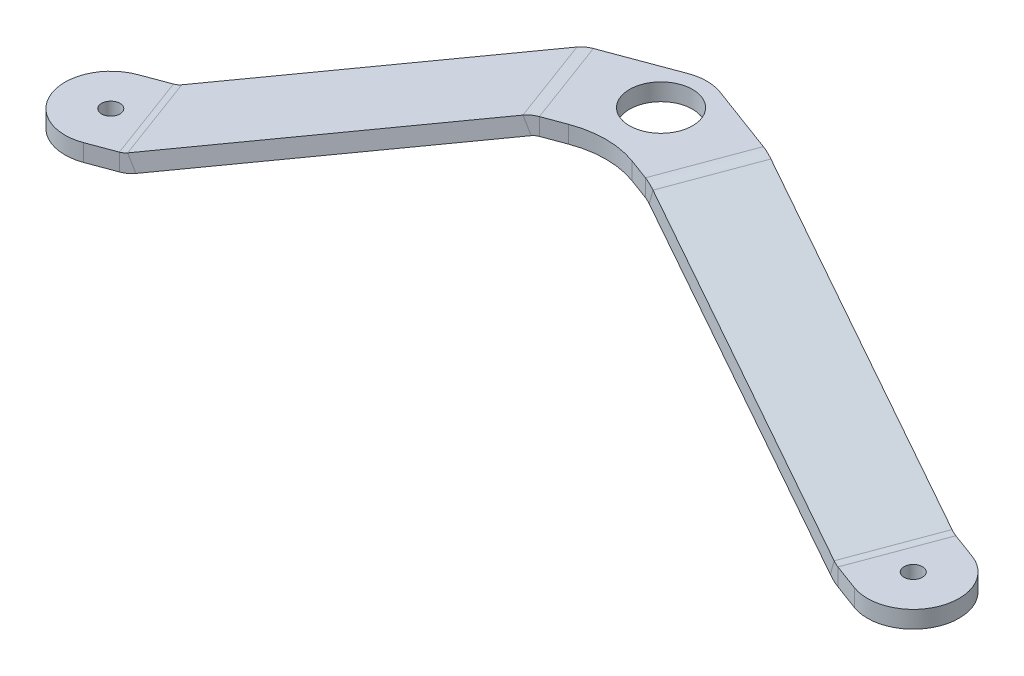
from build123d import *

# Parameters (mm, degrees)
SKETCH1_R              = 12.7
SKETCH1_R_2            = 8.73125
BOSS_EXTRUDE1_DEPTH    = 4.7625
BOSS_EXTRUDE5_DEPTH    = 4.7625
BOSS_EXTRUDE2_DEPTH    = 4.7625
BOSS_EXTRUDE2_2_DEPTH  = 4.7625
BOSS_EXTRUDE3_DEPTH    = 12.7
FILLET2_R              = 25.4
F_10_CLEARANCE_HOLE1_D = 5.1054
CONVERT_SOLID1_START   = -12.7
CONVERT_SOLID1_DEPTH   = 25.4
CONVERT_SOLID1_2_DEPTH = 25.4
CONVERT_SOLID1_3_DEPTH = 25.4
CONVERT_SOLID1_4_DEPTH = 25.4


# Read off the part's stored shape, not the designer's step: Convert-Solid1
with BuildPart() as part:
    # Sketch1 → Boss-Extrude1 (new body)
    with BuildSketch(Plane(origin=(0, 0, 0), x_dir=(1, 0, 0), z_dir=(0, 1, 0))):
        with Locations(Location((0, 0, 0), (0, 0, 90))):
            Circle(SKETCH1_R)
        with Locations(Location((0, 0, 0), (0, 0, 90))):
            Circle(SKETCH1_R_2, mode=Mode.SUBTRACT)
    extrude(amount=BOSS_EXTRUDE1_DEPTH)

    # Sketch1<5> → Boss-Extrude5 (add)
    with BuildSketch(Plane(origin=(0, 0, 0), x_dir=(1, 0, 0), z_dir=(0, 1, 0))):
        with BuildLine():
            Line((-25.256245596, 4.166855334), (-16.412307744, -19.643746575))
            Line((-16.412307744, -19.643746575), (0, -13.547746556))
            Line((0, -13.547746556), (-4.421968926, -11.905300955))
            ThreePointArc((-4.421968926, -11.905300955), (-12.7, 0), (-4.421968926, 11.905300955))
            Line((-4.421968926, 11.905300955), (-25.256245596, 4.166855334))
        make_face()
        with BuildLine():
            Line((-4.421968926, -11.905300955), (0, -13.547746556))
            Line((0, -13.547746556), (4.421968926, -11.905300955))
            ThreePointArc((4.421968926, -11.905300955), (0, -12.7), (-4.421968926, -11.905300955))
        make_face()
        with BuildLine():
            Line((4.421968926, -11.905300955), (0, -13.547746556))
            Line((0, -13.547746556), (16.412307744, -19.643746575))
            Line((16.412307744, -19.643746575), (25.256245596, 4.166855334))
            Line((25.256245596, 4.166855334), (4.421968926, 11.905300955))
            ThreePointArc((4.421968926, 11.905300955), (10.427104233, 7.250206709), (12.7, 0))
            ThreePointArc((12.7, 0), (10.427104233, -7.250206709), (4.421968926, -11.905300955))
        make_face()
    extrude(amount=BOSS_EXTRUDE5_DEPTH)



with BuildPart() as body_2:
    # Sketch3 → Boss-Extrude2 (new body)
    with BuildSketch(Plane(origin=(0, -35.179, 0), x_dir=(1, 0, 0), z_dir=(0, 1, 0))):
        with BuildLine():
            Line((-106.61799321, -26.053222351), (-115.546968926, -29.369699045))
            ThreePointArc((-115.546968926, -29.369699045), (-123.030300955, -45.696968926), (-106.703031074, -53.180300955))
            Line((-106.703031074, -53.180300955), (-97.774055358, -49.86382426))
            Line((-97.774055358, -49.86382426), (-106.61799321, -26.053222351))
        make_face()
    extrude(amount=BOSS_EXTRUDE2_DEPTH)


with BuildPart() as body_3:
    # Sketch3 → Boss-Extrude2 2 (new body)
    with BuildSketch(Plane(origin=(0, -35.179, 0), x_dir=(1, 0, 0), z_dir=(0, 1, 0))):
        with BuildLine():
            ThreePointArc((115.546968926, -29.369699045), (123.030300955, -45.696968926), (106.703031074, -53.180300955))
            Line((106.703031074, -53.180300955), (97.774055358, -49.86382426))
            Line((97.774055358, -49.86382426), (106.61799321, -26.053222351))
            Line((106.61799321, -26.053222351), (115.546968926, -29.369699045))
        make_face()
    extrude(amount=BOSS_EXTRUDE2_2_DEPTH)


with BuildPart() as part_1:
    add(part.part)

    add(body_2.part)  # Boss-Extrude3 merges body 2
    # Sketch4 → Boss-Extrude3 (add, symmetric)
    with BuildSketch(Plane(origin=(0, 0, 0), x_dir=(0.9374252720097653, 0, -0.34818652960362706), z_dir=(0.34818652960362706, 0, 0.9374252720097653))):
        Polygon((-109.937239497, -30.4165), (-109.017782361, -30.4165), (-109.017782361, -35.179), (-21.305542864, 0), (-22.225, 0), (-22.225, 4.7625), align=None)
    boss_extrude3 = extrude(amount=BOSS_EXTRUDE3_DEPTH, both=True)

    # Mirror1: Boss-Extrude3 across plane
    add(boss_extrude3.mirror(Plane(origin=(0, 0, 0), x_dir=(0, 0, 1), z_dir=(1, 0, 0))))


with BuildPart() as body_3_1:
    add(body_3.part)

    # Combine1: union part
    add(part_1.part)

    # Fillet2
    fillet2_edges = [body_3_1.edges().sort_by_distance(p)[0] for p in [
        (0, 2.38125, 13.547746556),
    ]]
    fillet(fillet2_edges, radius=FILLET2_R)

    # #10 Clearance Hole1 (through all)
    with Locations(Plane(origin=(0, -30.4165, 0), x_dir=(1, 0, 0), z_dir=(0, 1, 0))):
        with Locations((-111.125, -41.275), (111.125, -41.275)):
            Hole(F_10_CLEARANCE_HOLE1_D / 2)

    # Convert-Solid1 outline → Convert-Solid1 (add)
    with BuildSketch(Plane(origin=(0, 0, 0), x_dir=(0.9374252720097653, 0, -0.3481865296036272), z_dir=(0.34818652960362717, 0, 0.9374252720097654)).offset(CONVERT_SOLID1_START)):
        with BuildLine():
            ThreePointArc((-109.083861056, -30.074233056), (-109.953910301, -30.330150456), (-110.856696633, -30.4165))
            Line((-110.856696633, -30.4165), (-109.937239497, -30.4165))
            Line((-109.937239497, -30.4165), (-109.083861056, -30.074233056))
        make_face()
        with BuildLine():
            Line((-21.305542864, 0), (-22.158921305, -0.342266944))
            ThreePointArc((-22.158921305, -0.342266944), (-21.28887206, -0.086349544), (-20.386085729, 0))
            Line((-20.386085729, 0), (-21.305542864, 0))
        make_face()
    extrude(amount=CONVERT_SOLID1_DEPTH)

    # Convert-Solid1 2 outline → Convert-Solid1 2 (add)
    with BuildSketch(Plane(origin=(0, 0, 0), x_dir=(0.9374252720097653, 0, 0.3481865296036272), z_dir=(0.34818652960362717, 0, -0.9374252720097654)).offset(CONVERT_SOLID1_START)):
        with BuildLine():
            ThreePointArc((109.083861056, 30.074233056), (109.953910301, 30.330150456), (110.856696633, 30.4165))
            Line((110.856696633, 30.4165), (109.937239497, 30.4165))
            Line((109.937239497, 30.4165), (109.083861056, 30.074233056))
        make_face()
        with BuildLine():
            Line((21.305542864, 0), (22.158921305, 0.342266944))
            ThreePointArc((22.158921305, 0.342266944), (21.28887206, 0.086349544), (20.386085729, 0))
            Line((20.386085729, 0), (21.305542864, 0))
        make_face()
    extrude(amount=CONVERT_SOLID1_2_DEPTH)

    # Convert-Solid1 3 outline → Convert-Solid1 3 (cut)
    with BuildSketch(Plane(origin=(0, 0, 0), x_dir=(0.9374252720097653, 0, -0.3481865296036272), z_dir=(0.34818652960362717, 0, 0.9374252720097654)).offset(CONVERT_SOLID1_START)):
        with BuildLine():
            Line((-22.225, 4.7625), (-23.931756882, 4.077966112))
            ThreePointArc((-23.931756882, 4.077966112), (-22.191658392, 4.589800912), (-20.386085729, 4.7625))
            Line((-20.386085729, 4.7625), (-22.225, 4.7625))
        make_face()
        with BuildLine():
            ThreePointArc((-107.31102548, -34.494466112), (-109.05112397, -35.006300912), (-110.856696633, -35.179))
            Line((-110.856696633, -35.179), (-109.017782361, -35.179))
            Line((-109.017782361, -35.179), (-107.31102548, -34.494466112))
        make_face()
    extrude(amount=CONVERT_SOLID1_3_DEPTH, mode=Mode.SUBTRACT)

    # Convert-Solid1 4 outline → Convert-Solid1 4 (cut)
    with BuildSketch(Plane(origin=(0, 0, 0), x_dir=(0.9374252720097653, 0, 0.3481865296036272), z_dir=(0.34818652960362717, 0, -0.9374252720097654)).offset(CONVERT_SOLID1_START)):
        with BuildLine():
            Line((22.225, -4.7625), (23.931756882, -4.077966112))
            ThreePointArc((23.931756882, -4.077966112), (22.191658392, -4.589800912), (20.386085729, -4.7625))
            Line((20.386085729, -4.7625), (22.225, -4.7625))
        make_face()
        with BuildLine():
            ThreePointArc((107.31102548, 34.494466112), (109.05112397, 35.006300912), (110.856696633, 35.179))
            Line((110.856696633, 35.179), (109.017782361, 35.179))
            Line((109.017782361, 35.179), (107.31102548, 34.494466112))
        make_face()
    extrude(amount=CONVERT_SOLID1_4_DEPTH, mode=Mode.SUBTRACT)


solid = body_3_1.part
